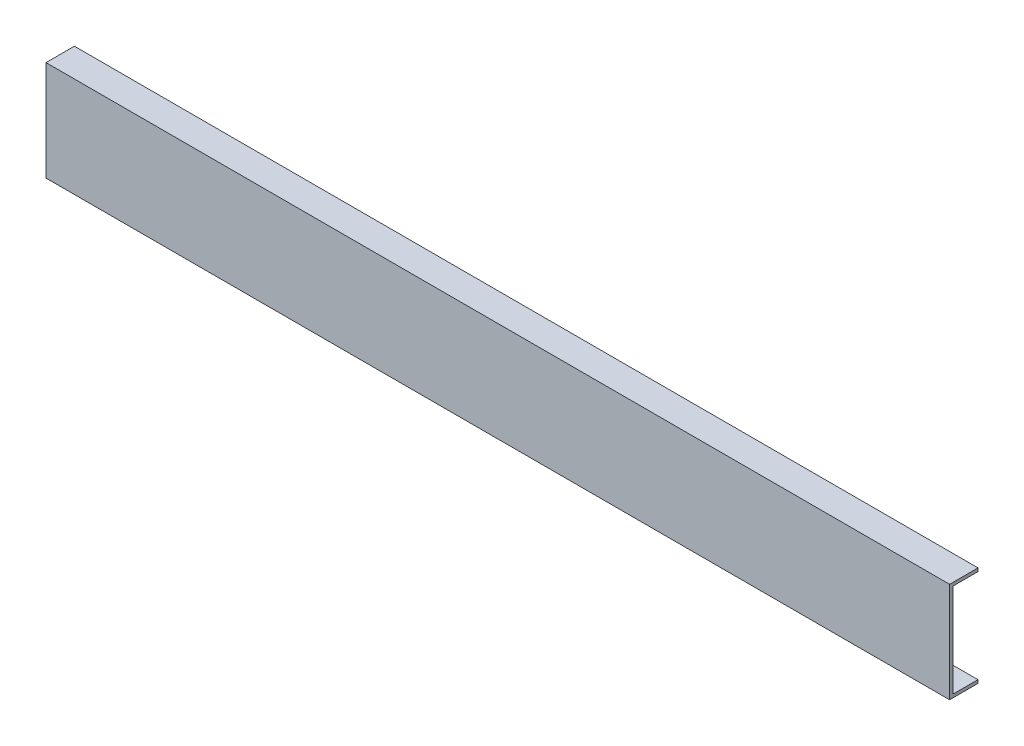
from build123d import *

# Parameters (mm, degrees)
SKETCH2_W           = 711.2
SKETCH2_H           = 78.74
BOSS_EXTRUDE1_DEPTH = 22.352
SKETCH3_W           = 19.812
SKETCH3_H           = 73.66
CUT_EXTRUDE1_DEPTH  = 716.894572897


with BuildPart() as part:
    # Sketch2 → Boss-Extrude1 (new body)
    with BuildSketch(Plane.XY):
        with Locations((355.6, 39.37)):
            Rectangle(SKETCH2_W, SKETCH2_H)
    extrude(amount=BOSS_EXTRUDE1_DEPTH)

    # Sketch3 → Cut-Extrude1 (cut, through all)
    with BuildSketch(Plane(origin=(711.2, 0, 0), x_dir=(0, 0, -1), z_dir=(1, 0, 0))):
        with Locations((-9.906, 39.37)):
            Rectangle(SKETCH3_W, SKETCH3_H)
    extrude(amount=-CUT_EXTRUDE1_DEPTH, mode=Mode.SUBTRACT)


solid = part.part
